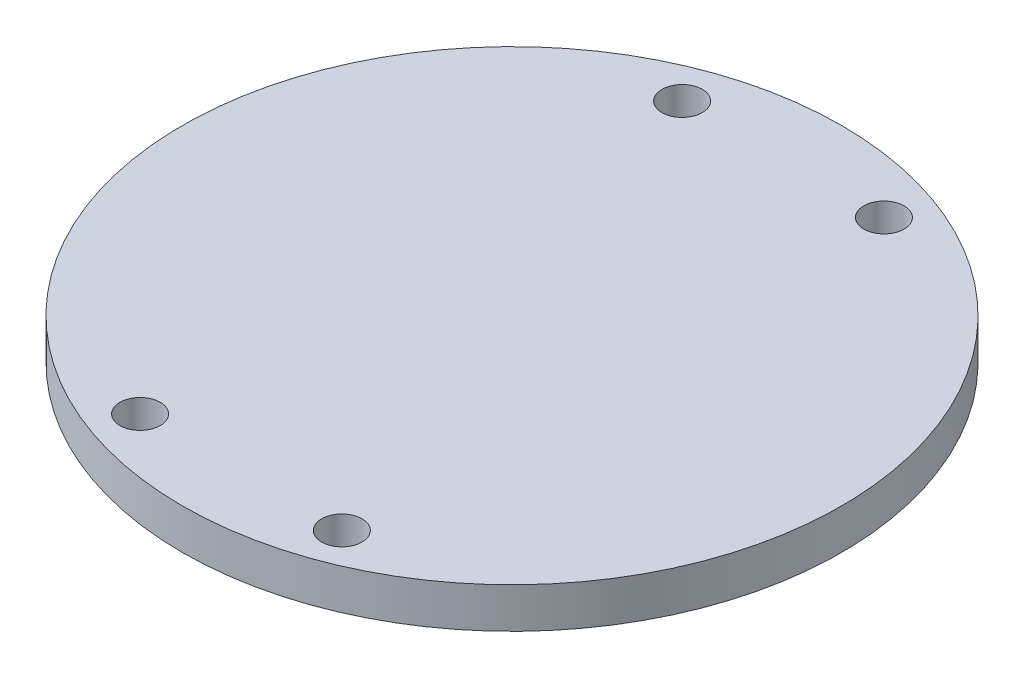
from build123d import *

# Parameters (mm, degrees)
SKETCH1_R           = 49
BOSS_EXTRUDE1_DEPTH = 6
SKETCH2_R           = 3
CUT_EXTRUDE2_DEPTH  = 6


with BuildPart() as part:
    # Sketch1 → Boss-Extrude1 (new body)
    with BuildSketch(Plane(origin=(0, 0, 0), x_dir=(1, 0, 0), z_dir=(0, 1, 0))):
        Circle(SKETCH1_R)
    extrude(amount=BOSS_EXTRUDE1_DEPTH)

    # Sketch2 → Cut-Extrude2 (cut)
    with BuildSketch(Plane(origin=(0, 6, 0), x_dir=(1, 0, 0), z_dir=(0, 1, 0))):
        with Locations((-15, 40.298883359)):
            Circle(SKETCH2_R)
        with Locations((15, 40.298883359)):
            Circle(SKETCH2_R)
        with Locations((-15, -40.298883359)):
            Circle(SKETCH2_R)
        with Locations((15, -40.298883359)):
            Circle(SKETCH2_R)
    extrude(amount=-CUT_EXTRUDE2_DEPTH, mode=Mode.SUBTRACT)


solid = part.part
